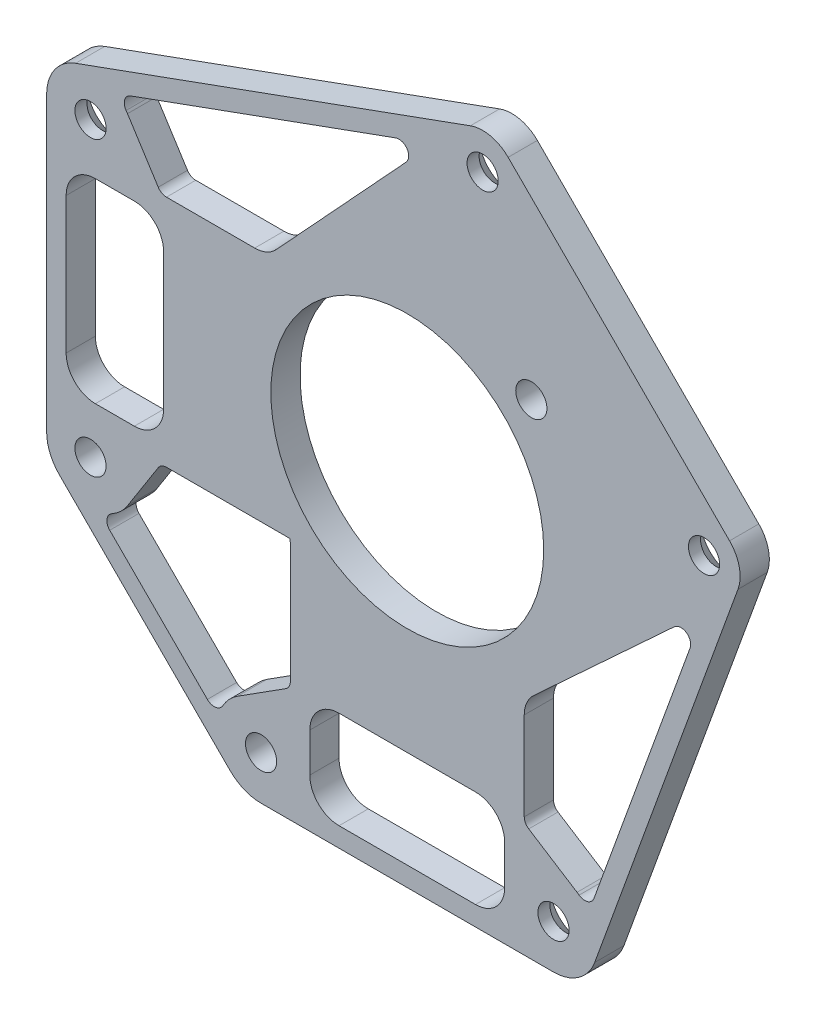
from build123d import *

# Parameters (mm, degrees)
SKETCH1_R                    = 14
BOSS_EXTRUDE1_DEPTH          = 3
FILLET1_R                    = 3
M3_CLEARANCE_HOLE1_D         = 3.2
CSK_FOR_M3_SFHCS1_AT_2_COUNT = 2
CSK_FOR_M3_SFHCS1_AT_2_PITCH = 32.126856443
BOSS_EXTRUDE3_START          = -3
BOSS_EXTRUDE3_DEPTH          = 3
M3_CLEARANCE_HOLE2_D         = 3.2
BOSS_EXTRUDE4_DEPTH          = 3
FILLET2_R                    = 1


with BuildPart() as part:
    # Sketch1 → Boss-Extrude1 (new body)
    with BuildSketch(Plane.XY):
        with BuildLine():
            Line((-7.713858659, 20.231714727), (-27.069818728, -0.727922061))
            Line((-27.069818728, -0.727922061), (-40.727922061, -0.727922061))
            Line((-40.727922061, -0.727922061), (-44.727922061, -0.727922061))
            ThreePointArc((-44.727922061, -0.727922061), (-48.263455967, -2.192388155), (-49.727922061, -5.727922061))
            Line((-49.727922061, -5.727922061), (-49.727922061, -19.727922061))
            ThreePointArc((-49.727922061, -19.727922061), (-48.263455967, -23.263455967), (-44.727922061, -24.727922061))
            Line((-44.727922061, -24.727922061), (-40.727922061, -24.727922061))
            Line((-40.727922061, -24.727922061), (-24.76951664, -24.727922061))
            ThreePointArc((-24.76951664, -24.727922061), (-24.748737342, -24.748737342), (-24.727922061, -24.76951664))
            Line((-24.727922061, -24.76951664), (-24.727922061, -40.727922061))
            Line((-24.727922061, -40.727922061), (-24.727922061, -44.727922061))
            ThreePointArc((-24.727922061, -44.727922061), (-23.263455967, -48.263455967), (-19.727922061, -49.727922061))
            Line((-19.727922061, -49.727922061), (-5.727922061, -49.727922061))
            ThreePointArc((-5.727922061, -49.727922061), (-2.192388155, -48.263455967), (-0.727922061, -44.727922061))
            Line((-0.727922061, -44.727922061), (-0.727922061, -40.727922061))
            Line((-0.727922061, -40.727922061), (-0.727922061, -27.069818728))
            Line((-0.727922061, -27.069818728), (20.231714727, -7.713858659))
            ThreePointArc((20.231714727, -7.713858659), (21.420744979, -5.069187867), (20.337771086, -2.379346963))
            Line((20.337771086, -2.379346963), (-2.379346963, 20.337771086))
            ThreePointArc((-2.379346963, 20.337771086), (-5.069187867, 21.420744979), (-7.713858659, 20.231714727))
        make_face()
        with Locations((-12.727922061, -12.727922061)):
            Circle(SKETCH1_R, mode=Mode.SUBTRACT)
        with BuildLine():
            Line((-44.727922061, -22.727922061), (-40.727922061, -22.727922061))
            ThreePointArc((-40.727922061, -22.727922061), (-38.606601718, -21.849242405), (-37.727922061, -19.727922061))
            Line((-37.727922061, -19.727922061), (-37.727922061, -5.727922061))
            ThreePointArc((-37.727922061, -5.727922061), (-38.606601718, -3.606601718), (-40.727922061, -2.727922061))
            Line((-40.727922061, -2.727922061), (-44.727922061, -2.727922061))
            ThreePointArc((-44.727922061, -2.727922061), (-46.849242405, -3.606601718), (-47.727922061, -5.727922061))
            Line((-47.727922061, -5.727922061), (-47.727922061, -19.727922061))
            ThreePointArc((-47.727922061, -19.727922061), (-46.849242405, -21.849242405), (-44.727922061, -22.727922061))
        make_face(mode=Mode.SUBTRACT)
        with BuildLine():
            Line((-19.727922061, -37.727922061), (-5.727922061, -37.727922061))
            ThreePointArc((-5.727922061, -37.727922061), (-3.606601718, -38.606601718), (-2.727922061, -40.727922061))
            Line((-2.727922061, -40.727922061), (-2.727922061, -44.727922061))
            ThreePointArc((-2.727922061, -44.727922061), (-3.606601718, -46.849242405), (-5.727922061, -47.727922061))
            Line((-5.727922061, -47.727922061), (-19.727922061, -47.727922061))
            ThreePointArc((-19.727922061, -47.727922061), (-21.849242405, -46.849242405), (-22.727922061, -44.727922061))
            Line((-22.727922061, -44.727922061), (-22.727922061, -40.727922061))
            ThreePointArc((-22.727922061, -40.727922061), (-21.849242405, -38.606601718), (-19.727922061, -37.727922061))
        make_face(mode=Mode.SUBTRACT)
    extrude(amount=BOSS_EXTRUDE1_DEPTH)

    # Fillet1
    # the kernel refuses this fillet: 3 mm, written as the material it adds along each edge
    with BuildSketch(Plane(origin=(-0.727922061, -27.069818728, 0), x_dir=(0.734653136445674, 0.6784429004054313, 0), z_dir=(0, 0, 1)), Plane(origin=(-27.069818728, -0.727922061, 0), x_dir=(-1, 0, 0), z_dir=(0, 0, 1))) as fillet1_piece_1:
        with BuildLine():
            CenterArc((FILLET1_R * 0.437699212924, -FILLET1_R), FILLET1_R, 90, 47.277914711)
            Line((-FILLET1_R * 0.296953923521, -FILLET1_R * 0.321557099595), (-FILLET1_R * 0.31164698625, -FILLET1_R * 0.307988241586))
            Line((-FILLET1_R * 0.31164698625, -FILLET1_R * 0.307988241586), (-FILLET1_R * 0.00875398425848, FILLET1_R * 0.02))
            Line((-FILLET1_R * 0.00875398425848, FILLET1_R * 0.02), (FILLET1_R * 0.437699212924, FILLET1_R * 0.02))
            Line((FILLET1_R * 0.437699212924, FILLET1_R * 0.02), (FILLET1_R * 0.437699212924, 0))
        make_face()
    extrude(amount=3)
    with BuildSketch(Plane(origin=(-24.727922061, -24.76951664, 0), x_dir=(-0.7071067811869401, 0.707106781186155, 0), z_dir=(0, 0, 1))) as fillet1_piece_2:
        with BuildLine():
            CenterArc((1.798711298, 2.443929389), FILLET1_R, 225, 9.552090636)
            Line((-0.322609046, 0.322609046), (-0.365035452, 0.280182639))
            Line((-0.365035452, 0.280182639), (-0.042426407, -0.042426407))
            Line((-0.042426407, -0.042426407), (0.000103806, -0.05999991))
            ThreePointArc((0.000103806, -0.05999991), (0.029411809, -0.059974557), (0.024025864, -0.048878588))
            Line((0.024025864, -0.048878588), (0.058823617, 0))
        make_face()
    extrude(amount=3)

    # M3 Clearance Hole1 (through all)
    with Locations(Plane(origin=(0, 0, 0), x_dir=(-1, 0, 0), z_dir=(0, 0, -1))):
        with Locations((0, 0)):
            Hole(M3_CLEARANCE_HOLE1_D / 2)

    # Sketch5 → CSK for M3 SFHCS1 (revolve, cut)
    with BuildSketch(Plane(origin=(-4.995642054, 17.721475995, 0), x_dir=(0, 1, 0), z_dir=(1, 0, 0))):
        Polygon((0, 0), (0, 3), (1.6, 3), (1.6, 1.76), (3.36, 0), align=None)
    csk_for_m3_sfhcs1 = revolve(axis=Axis((-4.995642054, 17.721475995, -6.35), (0, 0, 1)), mode=Mode.SUBTRACT)

    # CSK for M3 SFHCS1 at 2: CSK for M3 SFHCS1 ×2
    with Locations(*[Vector(0.7071067811865475, -0.7071067811865477, 0) * (i * CSK_FOR_M3_SFHCS1_AT_2_PITCH) for i in range(1, CSK_FOR_M3_SFHCS1_AT_2_COUNT)]):
        add(csk_for_m3_sfhcs1, mode=Mode.SUBTRACT)

    # Sketch8 → Boss-Extrude3 (add)
    with BuildSketch(Plane.XY.offset(3).offset(BOSS_EXTRUDE3_START)):
        with BuildLine():
            Line((-49.727922061, 2.272077939), (-49.727922061, -5.727922061))
            ThreePointArc((-49.727922061, -5.727922061), (-48.263455967, -2.192388155), (-44.727922061, -0.727922061))
            Line((-44.727922061, -0.727922061), (-37.983715361, -0.727922061))
            Line((-37.983715361, -0.727922061), (-41.431833634, 4.688627679))
            ThreePointArc((-41.431833634, 4.688627679), (-46.486413634, 6.592517611), (-49.727922061, 2.272077939))
        make_face()
        with BuildLine():
            Line((-41.431833634, -30.144471802), (-37.983715361, -24.727922061))
            Line((-37.983715361, -24.727922061), (-44.727922061, -24.727922061))
            ThreePointArc((-44.727922061, -24.727922061), (-48.263455967, -23.263455967), (-49.727922061, -19.727922061))
            Line((-49.727922061, -19.727922061), (-49.727922061, -27.727922061))
            ThreePointArc((-49.727922061, -27.727922061), (-46.486413634, -32.048361734), (-41.431833634, -30.144471802))
        make_face()
    boss_extrude3 = extrude(amount=BOSS_EXTRUDE3_DEPTH)

    # Sketch10 → CSK for M3 SFHCS2 (revolve, cut)
    with BuildSketch(Plane(origin=(-45.227922061, 2.272077939, 0), x_dir=(0, 1, 0), z_dir=(1, 0, 0))):
        Polygon((0, 0), (0, 3), (1.6, 3), (1.6, 1.76), (3.36, 0), align=None)
    csk_for_m3_sfhcs2 = revolve(axis=Axis((-45.227922061, 2.272077939, -6.35), (0, 0, 1)), mode=Mode.SUBTRACT)

    # M3 Clearance Hole2 (through all)
    with Locations(Plane(origin=(0, 0, 0), x_dir=(-1, 0, 0), z_dir=(0, 0, -1))):
        with Locations((45.227922061, -27.727922061)):
            m3_clearance_hole2 = Hole(M3_CLEARANCE_HOLE2_D / 2)

    # Mirror1: Boss-Extrude3, CSK for M3 SFHCS2, M3 Clearance Hole2 across plane
    add(boss_extrude3.mirror(Plane(origin=(0, 0, 0), x_dir=(0, 0, 1), z_dir=(-0.7071067811865475, 0.7071067811865477, 0))))
    add(csk_for_m3_sfhcs2.mirror(Plane(origin=(0, 0, 0), x_dir=(0, 0, 1), z_dir=(-0.7071067811865475, 0.7071067811865477, 0))), mode=Mode.SUBTRACT)
    add(m3_clearance_hole2.mirror(Plane(origin=(0, 0, 0), x_dir=(0, 0, 1), z_dir=(-0.7071067811865475, 0.7071067811865477, 0))), mode=Mode.SUBTRACT)

    # Sketch13 → Boss-Extrude4 (add)
    with BuildSketch(Plane(origin=(0, 0, 0), x_dir=(-1, 0, 0), z_dir=(0, 0, -1))):
        with BuildLine():
            Line((-21.199587058, -6.257681448), (-6.502213015, -46.762834838))
            ThreePointArc((-6.502213015, -46.762834838), (-6.726271236, -44.587483093), (-5.898401366, -42.563381125))
            Line((-5.898401366, -42.563381125), (-17.692883881, -10.058436905))
            Line((-17.692883881, -10.058436905), (-20.231714727, -7.713858659))
            ThreePointArc((-20.231714727, -7.713858659), (-20.802903641, -7.043764039), (-21.199587058, -6.257681448))
        make_face()
        with BuildLine():
            Line((10.058436905, 17.692883881), (7.713858659, 20.231714727))
            ThreePointArc((7.713858659, 20.231714727), (7.043764039, 20.802903641), (6.257681448, 21.199587058))
            Line((6.257681448, 21.199587058), (46.762834838, 6.502213015))
            ThreePointArc((46.762834838, 6.502213015), (44.587483093, 6.726271236), (42.563381125, 5.898401366))
            Line((42.563381125, 5.898401366), (10.058436905, 17.692883881))
        make_face()
        with BuildLine():
            Line((30.909902577, -48.409902577), (48.409902577, -30.909902577))
            ThreePointArc((48.409902577, -30.909902577), (46.534165101, -32.034165101), (44.349937703, -32.141440325))
            Line((44.349937703, -32.141440325), (32.141440325, -44.349937703))
            ThreePointArc((32.141440325, -44.349937703), (32.034165101, -46.534165101), (30.909902577, -48.409902577))
        make_face()
    extrude(amount=-BOSS_EXTRUDE4_DEPTH)

    # Fillet2
    fillet2_edges = [part.edges().sort_by_distance(p)[0] for p in [
        (-37.983715361, -0.727922061, 1.5),
        (-37.983715361, -24.727922061, 1.5),
        (-0.727922061, -37.983715361, 1.5),
        (-24.727922061, -37.983715361, 1.5),
        (17.692883881, -10.058436905, 1.5),
        (5.898401366, -42.563381125, 1.5),
        (-42.563381125, 5.898401366, 1.5),
        (-10.058436905, 17.692883881, 1.5),
        (-32.141440325, -44.349937703, 1.5),
        (-44.349937703, -32.141440325, 1.5),
    ]]
    fillet(fillet2_edges, radius=FILLET2_R)


solid = part.part
